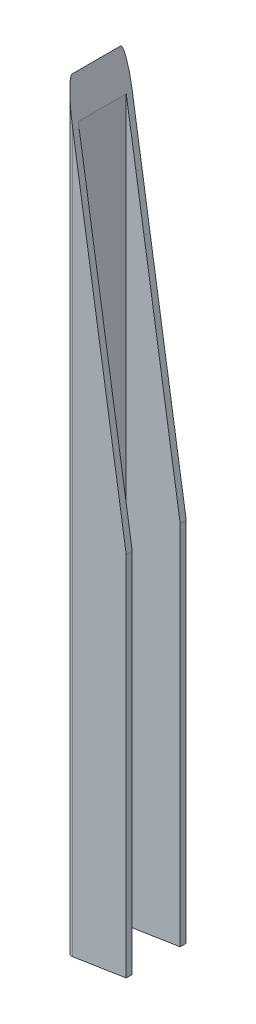
from build123d import *

# Parameters (mm, degrees)
SKETCH_1_W          = 74
SKETCH_1_H          = 24
EXTRUDE_1_DEPTH     = 380
SKETCH_2_W          = 51.146480438
SKETCH_2_H          = 42.897874587
CUT_EXTRUDE_1_DEPTH = 383.3937761
SKETCH_3_OUTSIDE_W  = 108.472
SKETCH_3_OUTSIDE_H  = 458.472
CUT_EXTRUDE_2_DEPTH = 384.275357935


with BuildPart() as part:
    # Эскиз1 → Вытянуть-Тонкостенный1 (new body)
    with BuildSketch(Plane(origin=(0, 0, 0), x_dir=(1, 0, 0), z_dir=(0, 1, 0))):
        with BuildLine():
            Line((40, 12), (40, -12))
            ThreePointArc((40, -12), (39.121320344, -14.121320344), (37, -15))
            Line((37, -15), (-37, -15))
            ThreePointArc((-37, -15), (-39.121320344, -14.121320344), (-40, -12))
            Line((-40, -12), (-40, 12))
            ThreePointArc((-40, 12), (-39.121320344, 14.121320344), (-37, 15))
            Line((-37, 15), (37, 15))
            ThreePointArc((37, 15), (39.121320344, 14.121320344), (40, 12))
        make_face()
        Rectangle(SKETCH_1_W, SKETCH_1_H, mode=Mode.SUBTRACT)
    extrude(amount=EXTRUDE_1_DEPTH)

    # Эскиз2 → Вырез-Вытянуть1 (cut, through all)
    with BuildSketch(Plane(origin=(0, 380, 0), x_dir=(1, 0, 0), z_dir=(0, 1, 0))):
        with Locations((15.573240219, -0.476163575)):
            Rectangle(SKETCH_2_W, SKETCH_2_H)
    extrude(amount=-CUT_EXTRUDE_1_DEPTH, mode=Mode.SUBTRACT)

    # Эскиз3 outside → Вырез-Вытянуть2 (cut, through all)
    with BuildSketch(Plane.XY.offset(15)):
        with Locations((-25, 190)):
            Rectangle(SKETCH_3_OUTSIDE_W, SKETCH_3_OUTSIDE_H)
        Polygon((-40, 380), (-10, 188.075345928), (-10, 4.689340222), (-40, 0), align=None, mode=Mode.SUBTRACT)
    extrude(amount=-CUT_EXTRUDE_2_DEPTH, mode=Mode.SUBTRACT)


solid = part.part
